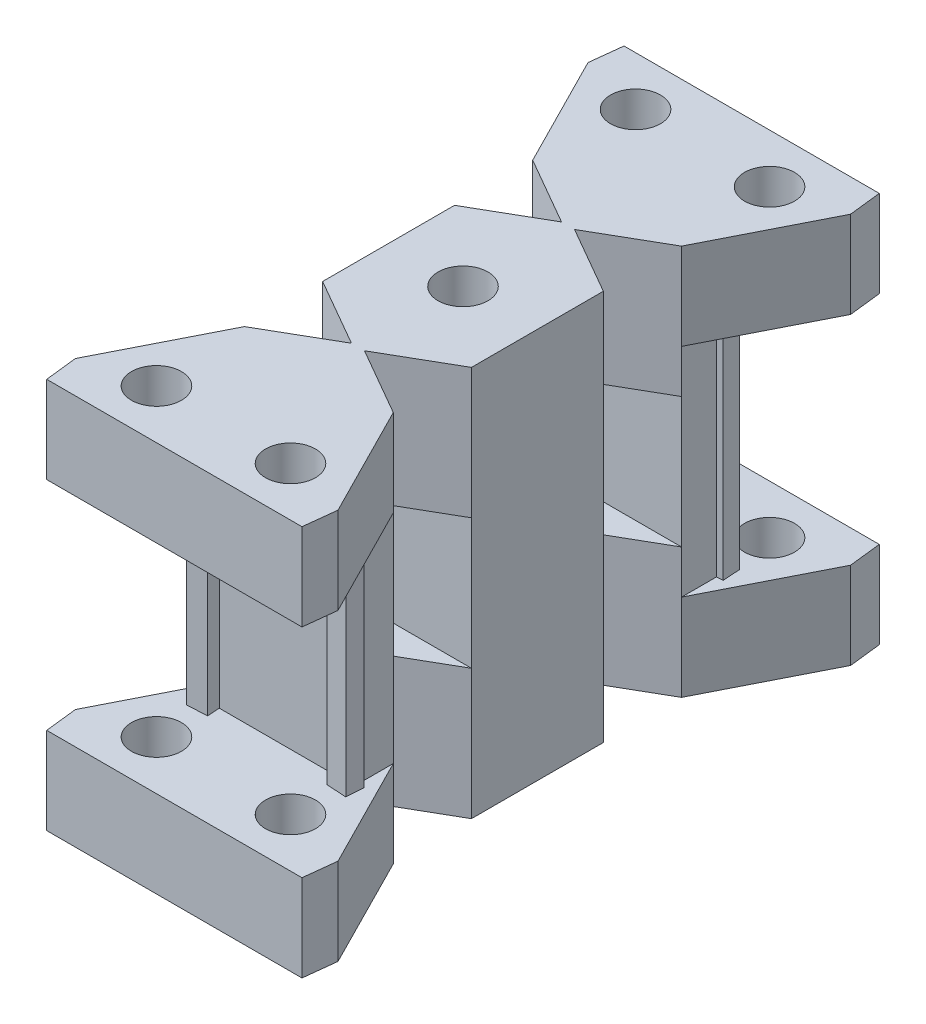
from build123d import *

# Parameters (mm, degrees)
SKETCH1_R            = 1.15
BOSS_EXTRUDE1_DEPTH  = 1
BOSS_EXTRUDE2_DEPTH  = 12
BOSS_EXTRUDE3_DEPTH  = 12
SKETCH6_W            = 6.853919328
SKETCH6_H            = 5
BOSS_EXTRUDE4_DEPTH  = 10
MIRROR2_START        = -11
MIRROR2_OUTLINE_R    = 1.15
MIRROR2_DEPTH        = 1
MIRROR2_START_2      = -10
MIRROR2_2_DEPTH      = 11
SKETCH7_W            = 11.75623079
SKETCH7_H            = 5.445993007
CUT_EXTRUDE1_DEPTH   = 22
SKETCH15_W           = 6.853919328
SKETCH15_H           = 5
BOSS_EXTRUDE8_DEPTH  = 6.873966159
CUT_EXTRUDE6_DEPTH   = 10
BOSS_EXTRUDE9_DEPTH  = 3.5
SKETCH19_R           = 1.15
CUT_EXTRUDE2_DEPTH   = 20
BOSS_EXTRUDE10_DEPTH = 1
BOSS_EXTRUDE11_START = 3
SKETCH27_R           = 1.15
BOSS_EXTRUDE11_DEPTH = 3
SKETCH28_W           = 13.273966158
SKETCH28_H           = 6
CUT_EXTRUDE7_DEPTH   = 13
SKETCH29_W           = 6.853919328
SKETCH29_H           = 6.073966158
SKETCH29_R           = 1.15
BOSS_EXTRUDE12_DEPTH = 13
BOSS_EXTRUDE13_DEPTH = 4


with BuildPart() as part:
    # Sketch1 → Boss-Extrude1 (new body)
    with BuildSketch(Plane(origin=(0, 0, 0), x_dir=(1, 0, 0), z_dir=(0, 1, 0))):
        Polygon((-6.046966624, 49.693438145), (-5.709264166, 46.7123956), (-3.10834847, 44.45145408), (-2.33209021, 44.498932069), (-0.026100804, 47.059992762), (0.026100804, 47.059992762), (2.33209021, 44.498932069), (3.10834847, 44.45145408), (5.709264166, 46.7123956), (6.046966624, 49.693438145), (3.66640026, 52.431966482), (2.75077786, 52.487968347), (0.054213226, 50.059970644), (-0.054213226, 50.059970644), (-2.75077786, 52.487968347), (-3.66640026, 52.431966482), align=None)
        with Locations(Location((-3.086614159, 50.465695408, 0), (0, 0, 270))):
            Circle(SKETCH1_R, mode=Mode.SUBTRACT)
        with Locations(Location((3.086614159, 50.465695408, 0), (0, 0, 270))):
            Circle(SKETCH1_R, mode=Mode.SUBTRACT)
        with Locations(Location((2.842648162, 46.476886618, 0), (0, 0, 270))):
            Circle(SKETCH1_R, mode=Mode.SUBTRACT)
        with Locations(Location((-2.842648162, 46.476886618, 0), (0, 0, 270))):
            Circle(SKETCH1_R, mode=Mode.SUBTRACT)
    boss_extrude1 = extrude(amount=BOSS_EXTRUDE1_DEPTH)

    # Sketch2 → Boss-Extrude2 (add)
    with BuildSketch(Plane(origin=(0, 1, 0), x_dir=(1, 0, 0), z_dir=(0, 1, 0))):
        Polygon((-3.66640026, 52.431966482), (-2.75077786, 52.487968347), (-2.799616692, 53.286476185), (-3.715239092, 53.23047432), align=None)
        Polygon((2.75077786, 52.487968347), (3.66640026, 52.431966482), (3.715239092, 53.23047432), (2.799616692, 53.286476185), align=None)
    extrude(amount=-BOSS_EXTRUDE2_DEPTH)

    # Mirror1: Boss-Extrude1 across plane
    add(boss_extrude1.mirror(Plane.ZX.offset(-5)))

    # Sketch3 → Boss-Extrude3 (add)
    with BuildSketch(Plane(origin=(0, 1, 0), x_dir=(1, 0, 0), z_dir=(0, 1, 0))):
        Polygon((2.33209021, 44.498932069), (3.10834847, 44.45145408), (3.059509638, 43.652946241), (2.283251379, 43.70042423), align=None)
        Polygon((-2.33209021, 44.498932069), (-3.10834847, 44.45145408), (-3.059509638, 43.652946241), (-2.283251379, 43.70042423), align=None)
    extrude(amount=-BOSS_EXTRUDE3_DEPTH)

    # Sketch6 → Boss-Extrude4 (add)
    with BuildSketch(Plane(origin=(0, 0, -53.059970644), x_dir=(-1, 0, 0), z_dir=(0, 0, -1))):
        with Locations((0, -5)):
            Rectangle(SKETCH6_W, SKETCH6_H)
    extrude(amount=BOSS_EXTRUDE4_DEPTH)



with BuildPart() as body_2:
    # Mirror2: read off the stored shape, not the designer's step
    # Mirror2 outline → Mirror2 (new body)
    with BuildSketch(Plane(origin=(0, 0, 0), x_dir=(1, 0, 0), z_dir=(0, 1, 0)).offset(MIRROR2_START)):
        Polygon((-3.715239092, 62.889466969), (-2.799616692, 62.833465104), (-2.75077786, 63.631972942), (-0.054213226, 66.059970644), (0.054213226, 66.059970644), (2.75077786, 63.631972942), (2.799616692, 62.833465104), (3.715239092, 62.889466969), (3.66640026, 63.687974807), (6.046966624, 66.426503144), (5.709264166, 69.407545689), (3.10834847, 71.668487209), (3.059509638, 72.466995048), (2.283251379, 72.419517059), (2.33209021, 71.62100922), (0.026100804, 69.059948527), (-0.026100804, 69.059948527), (-2.33209021, 71.62100922), (-2.283251379, 72.419517059), (-3.059509638, 72.466995048), (-3.10834847, 71.668487209), (-5.709264166, 69.407545689), (-6.046966624, 66.426503144), (-3.66640026, 63.687974807), align=None)
        with Locations((2.842648162, 69.643054671)):
            Circle(MIRROR2_OUTLINE_R, mode=Mode.SUBTRACT)
        with Locations((-3.086614159, 65.654245881)):
            Circle(MIRROR2_OUTLINE_R, mode=Mode.SUBTRACT)
        with Locations((3.086614159, 65.654245881)):
            Circle(MIRROR2_OUTLINE_R, mode=Mode.SUBTRACT)
        with Locations((-2.842648162, 69.643054671)):
            Circle(MIRROR2_OUTLINE_R, mode=Mode.SUBTRACT)
    mirror2 = extrude(amount=MIRROR2_DEPTH)


with BuildPart() as part_1:
    add(part.part)

    add(body_2.part)  # Mirror2 2 merges body 2
    # Mirror2 2 outline → Mirror2 2 (add)
    with BuildSketch(Plane(origin=(0, 0, 0), x_dir=(1, 0, 0), z_dir=(0, 1, 0)).offset(MIRROR2_START_2)):
        Polygon((-3.715239092, 62.889466969), (-2.799616692, 62.833465104), (-2.75077786, 63.631972942), (-3.66640026, 63.687974807), align=None)
        Polygon((3.66640026, 63.687974807), (2.75077786, 63.631972942), (2.799616692, 62.833465104), (3.715239092, 62.889466969), align=None)
        Polygon((-3.059509638, 72.466995048), (-3.10834847, 71.668487209), (-2.33209021, 71.62100922), (-2.283251379, 72.419517059), align=None)
        Polygon((2.33209021, 71.62100922), (3.10834847, 71.668487209), (3.059509638, 72.466995048), (2.283251379, 72.419517059), align=None)
    mirror2_2 = extrude(amount=MIRROR2_2_DEPTH)

    # Mirror3: Mirror2, Mirror2 2 across plane
    add(mirror2.mirror(Plane.ZX.offset(-5)))
    add(mirror2_2.mirror(Plane.ZX.offset(-5)))

    # Sketch7 → Cut-Extrude1 (cut)
    with BuildSketch(Plane.XZ.offset(11)):
        with Locations((0, -45.479920369)):
            Rectangle(SKETCH7_W, SKETCH7_H)
    cut_extrude1 = extrude(amount=-CUT_EXTRUDE1_DEPTH, mode=Mode.SUBTRACT)

    # Mirror4: Cut-Extrude1 across plane
    add(cut_extrude1.mirror(Plane.XY.offset(-58.059970644)), mode=Mode.SUBTRACT)


with BuildPart() as body_2_2:
    # Split1: the piece on the far side of the plane
    add(part_1.part)
    split(bisect_by=Plane.XY.offset(-58.059970644), keep=Keep.BOTTOM)


with BuildPart() as part_2:
    add(part_1.part)

    # Split1
    split(bisect_by=Plane.XY.offset(-58.059970644), keep=Keep.TOP)


with BuildPart() as part_3:
    # Body-Move/Copy1: moved
    add(part_2.part.moved(Location((0, 0, 6.873966159))))


with BuildPart() as part_4:
    # Body-Move/Copy2: moved
    add(part_3.part.moved(Location((20.680073688, 0, 0))))


with BuildPart() as part_5:
    # Body-Move/Copy4: read off the stored shape, not the designer's step
    # Body-Move/Copy4: moved
    add(part_4.part.moved(Location((-20.6800737, 0, 0))))


    add(body_2_2.part)  # Boss-Extrude8 merges body 2 2
    # Sketch15 → Boss-Extrude8 (add)
    with BuildSketch(Plane.XY.offset(-58.059970644)):
        with Locations((0, -5)):
            Rectangle(SKETCH15_W, SKETCH15_H)
    extrude(amount=BOSS_EXTRUDE8_DEPTH)

    # Sketch24 → Cut-Extrude6 (cut)
    with BuildSketch(Plane(origin=(0, -2.5, 0), x_dir=(1, 0, 0), z_dir=(0, 1, 0))):
        Polygon((-3.426959664, 61.259970644), (-3.426959664, 57.659970644), (-0.3, 59.459970644), align=None)
        Polygon((3.426959664, 61.259970644), (0.3, 59.459970644), (3.426959664, 57.659970644), align=None)
    cut_extrude6 = extrude(amount=-CUT_EXTRUDE6_DEPTH, mode=Mode.SUBTRACT)

    # Mirror8: Cut-Extrude6 across plane
    add(cut_extrude6.mirror(Plane.XY.offset(-54.622987565)), mode=Mode.SUBTRACT)

    # Sketch25 → Boss-Extrude9 (add)
    with BuildSketch(Plane(origin=(0, -2.5, 0), x_dir=(1, 0, 0), z_dir=(0, 1, 0))):
        Polygon((-3.426959664, 63.059970644), (-3.426959664, 61.259970644), (-0.3, 59.459970644), (-3.426959664, 57.659970644), (-3.426959664, 51.586004486), (-0.3, 49.786004486), (-3.426959664, 47.986004486), (-3.426959664, 46.186004486), (3.426959664, 46.186004486), (3.426959664, 47.986004486), (0.3, 49.786004486), (3.426959664, 51.586004486), (3.426959664, 57.659970644), (0.3, 59.459970644), (3.426959664, 61.259970644), (3.426959664, 63.059970644), align=None)
    boss_extrude9 = extrude(amount=BOSS_EXTRUDE9_DEPTH)

    # Mirror10: Boss-Extrude9 across plane
    add(boss_extrude9.mirror(Plane.ZX.offset(-5)))

    # Sketch19 → Cut-Extrude2 (cut)
    with BuildSketch(Plane(origin=(0, 1, 0), x_dir=(1, 0, 0), z_dir=(0, 1, 0))):
        with Locations(Location((0, 54.622987565, 0), (0, 0, 270))):
            Circle(SKETCH19_R)
    extrude(amount=-CUT_EXTRUDE2_DEPTH, mode=Mode.SUBTRACT)

    # Sketch26 → Boss-Extrude10 (add)
    with BuildSketch(Plane(origin=(0, 1, 0), x_dir=(1, 0, 0), z_dir=(0, 1, 0))):
        Polygon((-0.054213226, 66.059970644), (0.054213226, 66.059970644), (2.75077786, 63.631972942), (2.785763019, 63.059970644), (-2.785763019, 63.059970644), (-2.75077786, 63.631972942), align=None)
        Polygon((-2.785763019, 46.186004486), (2.785763019, 46.186004486), (2.75077786, 45.614002188), (0.054213226, 43.186004486), (-0.054213226, 43.186004486), (-2.75077786, 45.614002188), align=None)
    boss_extrude10 = extrude(amount=-BOSS_EXTRUDE10_DEPTH)

    # Mirror11: Boss-Extrude10 across plane
    add(boss_extrude10.mirror(Plane.ZX.offset(-5)))

    # Sketch27 → Boss-Extrude11 (add)
    with BuildSketch(Plane(origin=(0, 1, 0), x_dir=(1, 0, 0), z_dir=(0, 1, 0)).offset(BOSS_EXTRUDE11_START)):
        Polygon((-5.878115395, 67.917024417), (-6.046966624, 66.426503144), (-3.66640026, 63.687974807), (-3.715239092, 62.889466969), (-3.426959664, 62.871835043), (-3.426959664, 61.259970644), (-0.3, 59.459970644), (-3.426959664, 57.659970644), (-3.426959664, 51.586004486), (-0.3, 49.786004486), (-3.426959664, 47.986004486), (-3.426959664, 46.374140087), (-3.715239092, 46.356508162), (-3.66640026, 45.558000323), (-6.046966624, 42.819471986), (-5.878115395, 41.328950714), (5.878115395, 41.328950714), (6.046966624, 42.819471986), (3.66640026, 45.558000323), (3.715239092, 46.356508162), (3.426959664, 46.374140087), (3.426959664, 47.986004486), (0.3, 49.786004486), (3.426959664, 51.586004486), (3.426959664, 57.659970644), (0.3, 59.459970644), (3.426959664, 61.259970644), (3.426959664, 62.871835043), (3.715239092, 62.889466969), (3.66640026, 63.687974807), (6.046966624, 66.426503144), (5.878115395, 67.917024417), align=None)
        with Locations(Location((-3.086614159, 65.654245881, 0), (0, 0, 90))):
            Circle(SKETCH27_R, mode=Mode.SUBTRACT)
        with Locations(Location((3.086614159, 65.654245881, 0), (0, 0, 90))):
            Circle(SKETCH27_R, mode=Mode.SUBTRACT)
        with Locations(Location((0, 54.622987565, 0), (0, 0, 270))):
            Circle(SKETCH27_R, mode=Mode.SUBTRACT)
        with Locations(Location((-3.086614159, 43.59172925, 0), (0, 0, 270))):
            Circle(SKETCH27_R, mode=Mode.SUBTRACT)
        with Locations(Location((3.086614159, 43.59172925, 0), (0, 0, 270))):
            Circle(SKETCH27_R, mode=Mode.SUBTRACT)
    boss_extrude11 = extrude(amount=-BOSS_EXTRUDE11_DEPTH)

    # Mirror12: Boss-Extrude11 across plane
    add(boss_extrude11.mirror(Plane.ZX.offset(-5)))

    # Sketch28 → Cut-Extrude7 (cut)
    with BuildSketch(Plane.ZY.offset(3.426959664)):
        with Locations((-54.622987565, -5)):
            Rectangle(SKETCH28_W, SKETCH28_H)
    extrude(amount=-CUT_EXTRUDE7_DEPTH, mode=Mode.SUBTRACT)

    # Sketch29 → Boss-Extrude12 (add)
    with BuildSketch(Plane(origin=(0, 4, 0), x_dir=(1, 0, 0), z_dir=(0, 1, 0))):
        with Locations((0, 54.622987565)):
            Rectangle(SKETCH29_W, SKETCH29_H)
        with Locations(Location((0, 54.622987565, 0), (0, 0, 270))):
            Circle(SKETCH29_R, mode=Mode.SUBTRACT)
    extrude(amount=-BOSS_EXTRUDE12_DEPTH)

    # Sketch30 → Boss-Extrude13 (add)
    with BuildSketch(Plane(origin=(0, 4, 0), x_dir=(1, 0, 0), z_dir=(0, 1, 0))):
        Polygon((3.426959664, 61.259970644), (6.046966624, 66.426503144), (3.66640026, 63.687974807), (3.715239092, 62.889466969), (3.426959664, 62.871835043), align=None)
        Polygon((-6.046966624, 66.426503144), (-3.66640026, 63.687974807), (-3.715239092, 62.889466969), (-3.426959664, 62.871835043), (-3.426959664, 61.259970644), align=None)
        Polygon((3.426959664, 47.986004486), (3.426959664, 46.374140087), (3.715239092, 46.356508162), (3.66640026, 45.558000323), (6.046966624, 42.819471986), align=None)
        Polygon((-3.426959664, 47.986004486), (-3.426959664, 46.374140087), (-3.715239092, 46.356508162), (-3.66640026, 45.558000323), (-6.046966624, 42.819471986), align=None)
    boss_extrude13 = extrude(amount=-BOSS_EXTRUDE13_DEPTH)

    # Mirror13: Boss-Extrude13 across plane
    add(boss_extrude13.mirror(Plane.ZX.offset(-5)))


solid = part_5.part
